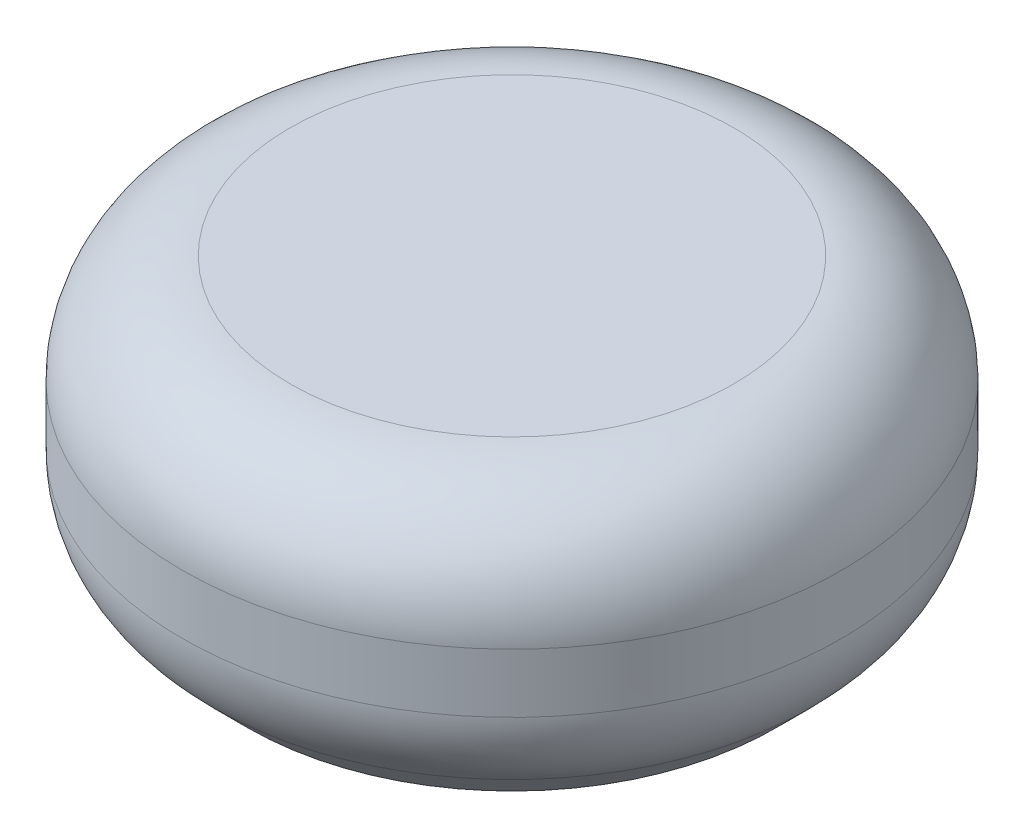
from build123d import *

# Parameters (mm, degrees)
SKETCH1_R           = 19.431
SKETCH1_R_2         = 15.5625
BOSS_EXTRUDE1_DEPTH = 15
SKETCH2_R           = 19.431
BOSS_EXTRUDE2_DEPTH = 3.81
FILLET1_R           = 6.35
CHAMFER1_SIZE       = 6.35
FILLET2_R           = 6.35


with BuildPart() as part:
    # Sketch1 → Boss-Extrude1 (new body)
    with BuildSketch(Plane(origin=(0, 0, 0), x_dir=(1, 0, 0), z_dir=(0, 1, 0))):
        with Locations(Location((0, 0, 0), (0, 0, 270))):
            Circle(SKETCH1_R)
        with Locations(Location((0, 0, 0), (0, 0, 270))):
            Circle(SKETCH1_R_2, mode=Mode.SUBTRACT)
    extrude(amount=BOSS_EXTRUDE1_DEPTH)

    # Sketch2 → Boss-Extrude2 (add)
    with BuildSketch(Plane(origin=(0, 15, 0), x_dir=(1, 0, 0), z_dir=(0, 1, 0))):
        with Locations(Location((0, 0, 0), (0, 0, 270))):
            Circle(SKETCH2_R)
    extrude(amount=BOSS_EXTRUDE2_DEPTH)

    # Fillet1
    fillet1_edges = [part.edges().sort_by_distance(p)[0] for p in [
        (0, 18.81, -19.431),
    ]]
    fillet(fillet1_edges, radius=FILLET1_R)

    # Chamfer1
    # the kernel refuses this chamfer: 6.35 mm, written as the material it takes off along each edge
    with BuildSketch(Plane(origin=(0, 0, 0), x_dir=(0, 0, 1), z_dir=(-1, 0, 0))) as chamfer1_piece_1:
        Polygon((19.431, CHAMFER1_SIZE), (19.431 - CHAMFER1_SIZE, 0), (19.431, 0), align=None)
    revolve(axis=Axis((0, 0, 0), (0, 1, 0)), mode=Mode.SUBTRACT)

    # Fillet2
    fillet2_edges = [part.edges().sort_by_distance(p)[0] for p in [
        (0, 6.35, -19.431),
    ]]
    fillet(fillet2_edges, radius=FILLET2_R)


solid = part.part
